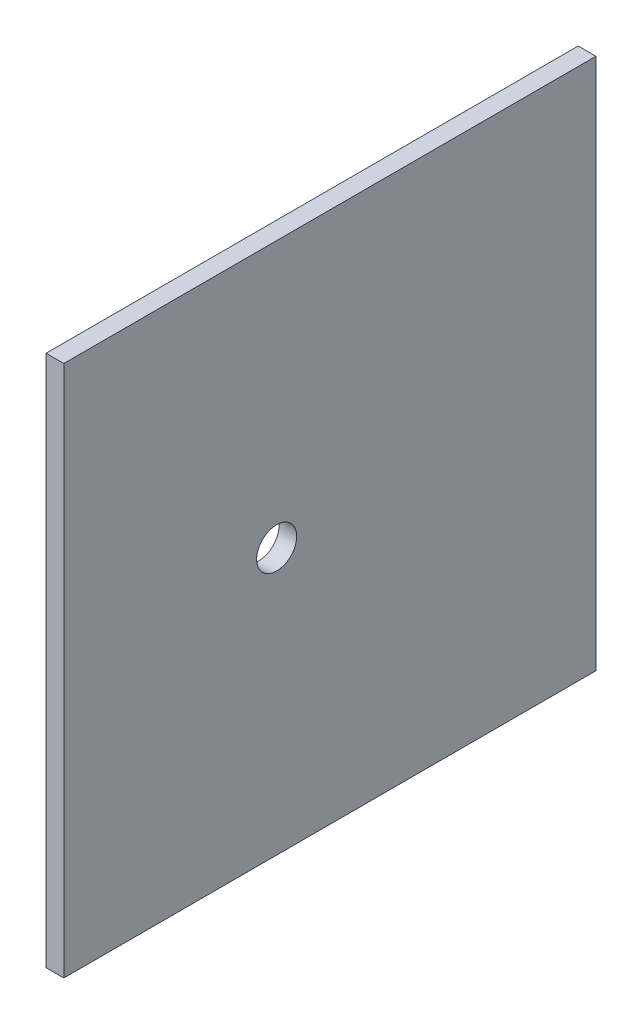
from build123d import *

# Parameters (mm, degrees)
SKETCH1_W           = 381
SKETCH1_H           = 381
SKETCH1_R           = 14.351
BOSS_EXTRUDE1_DEPTH = 12.7


with BuildPart() as part:
    # Sketch1 → Boss-Extrude1 (new body)
    with BuildSketch(Plane(origin=(0, 0, 0), x_dir=(0, 0, -1), z_dir=(1, 0, 0))):
        Rectangle(SKETCH1_W, SKETCH1_H)
        with Locations((-38.1, 0)):
            Circle(SKETCH1_R, mode=Mode.SUBTRACT)
    extrude(amount=BOSS_EXTRUDE1_DEPTH)


solid = part.part
